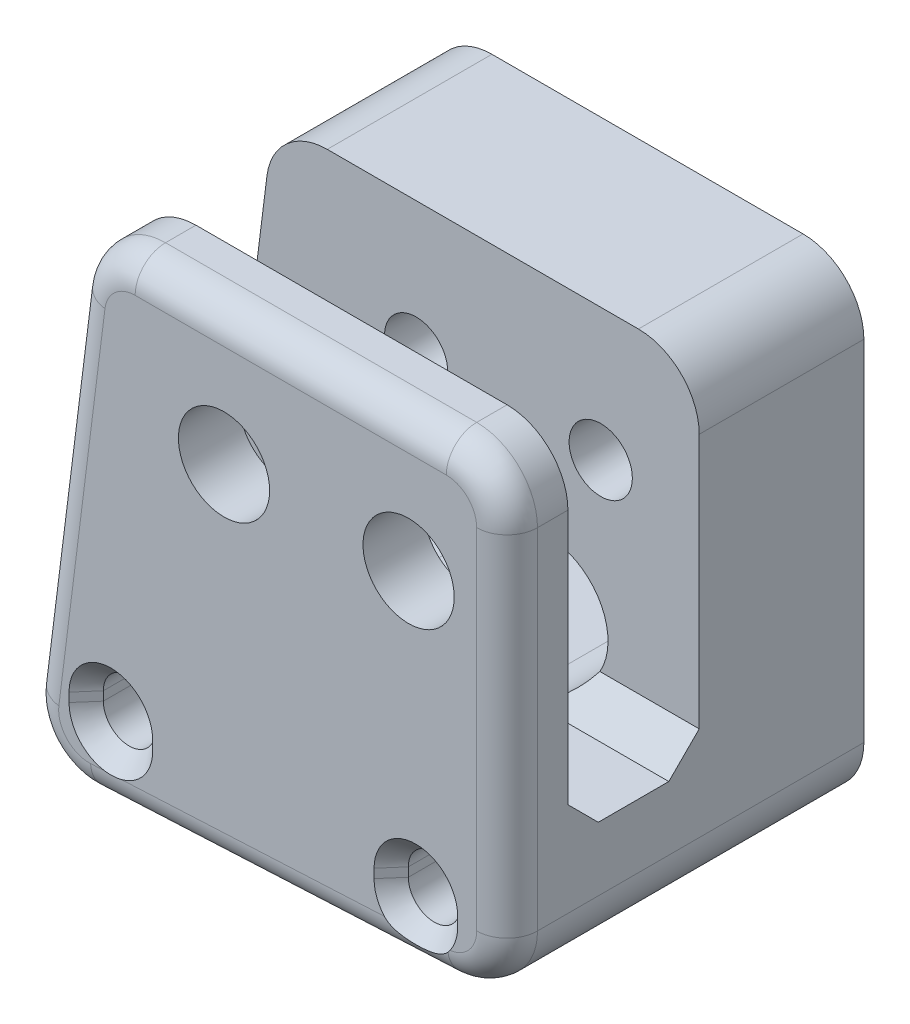
from build123d import *

# Parameters (mm, degrees)
BOSS_EXTRUDE1_DEPTH                           = 3.175
BOSS_EXTRUDE2_START                           = -6.858
BOSS_EXTRUDE2_DEPTH                           = 8.5979
BOSS_EXTRUDE3_DEPTH                           = 6.858
CSK_START                                     = -16
CSK_SLOT_FOR_2_FLAT_HEAD_MACHINE_SCREW1_DEPTH = 20
FILLET1_R                                     = 3.175
CHAMFER1_SIZE                                 = 1.5875
F_3_16_0_1875_DIAMETER_HOLE1_D                = 4.7625
F_3_16_0_1875_DIAMETER_HOLE1_DEPTH            = 3.175
F_0_CLEARANCE_HOLE1_D                         = 1.8542
HOLE1_AT_2_COUNT                              = 2
HOLE1_AT_2_PITCH                              = 9.6393
CUT_EXTRUDE2_REACH                            = 30.918
FILLET3_R                                     = 1.5875


with BuildPart() as part:
    # Sketch1 → Boss-Extrude1 (new body)
    with BuildSketch(Plane.XY):
        Polygon((9.9949, 9.271), (9.9949, -15.162995595), (-15.457511269, -16.426312325), (-12.2301, 9.271), align=None)
    extrude(amount=BOSS_EXTRUDE1_DEPTH)



with BuildPart() as body_2:
    # Sketch1<2> → Boss-Extrude2 (new body)
    with BuildSketch(Plane.XY.offset(BOSS_EXTRUDE2_START)):
        Polygon((9.9949, 9.271), (9.9949, -15.162995595), (-15.457511269, -16.426312325), (-12.2301, 9.271), align=None)
    extrude(amount=-BOSS_EXTRUDE2_DEPTH)


with BuildPart() as part_1:
    add(part.part)

    add(body_2.part)  # Boss-Extrude3 merges body 2
    # Sketch3 → Boss-Extrude3 (add)
    with BuildSketch(Plane.XY.offset(-6.858)):
        Polygon((9.9949, -8.812995595), (9.9949, -15.162995595), (-15.457511269, -16.426312325), (-14.501329397, -8.812995595), align=None)
    extrude(amount=BOSS_EXTRUDE3_DEPTH)

    # CSK SLOT for #2 Flat Head Machine Screw1: read off the stored shape, not the designer's step
    # CSK SLOT for _2 Flat Head Machine Sc 2 → CSK SLOT for #2 Flat Head Machine Screw1 (cut)
    with BuildSketch(Plane.XY.offset(CSK_START)):
        with BuildLine():
            Line((-9.342461269, -12.455421191), (-9.342461269, -11.985521191))
            ThreePointArc((-9.342461269, -11.985521191), (-10.695011269, -10.632971191), (-12.047561269, -11.985521191))
            Line((-12.047561269, -11.985521191), (-12.047561269, -12.455421191))
            ThreePointArc((-12.047561269, -12.455421191), (-10.695011269, -13.807971191), (-9.342461269, -12.455421191))
        make_face()
        with BuildLine():
            Line((6.58495, -12.455421191), (6.58495, -11.985521191))
            ThreePointArc((6.58495, -11.985521191), (5.2324, -10.632971191), (3.87985, -11.985521191))
            Line((3.87985, -11.985521191), (3.87985, -12.455421191))
            ThreePointArc((3.87985, -12.455421191), (5.2324, -13.807971191), (6.58495, -12.455421191))
        make_face()
    extrude(amount=CSK_SLOT_FOR_2_FLAT_HEAD_MACHINE_SCREW1_DEPTH, mode=Mode.SUBTRACT)

    # CSK SLOT for _2 Flat Head Machine Sc 3: loft between two sections, ruled curve by curve
    csk_slot_for_2_flat_head_machine_sc_3_from = [
        Edge.make_three_point_arc((-9.342461269, -11.985521191, 2.21806604), (-9.738613992, -11.029123914, 2.21806604), (-10.695011269, -10.632971191, 2.21806604)),
        Edge.make_three_point_arc((-10.695011269, -10.632971191, 2.21806604), (-11.651408546, -11.029123914, 2.21806604), (-12.047561269, -11.985521191, 2.21806604)),
        Edge.make_three_point_arc((-12.047561269, -12.455421191, 2.21806604), (-11.651408546, -13.411818468, 2.21806604), (-10.695011269, -13.807971191, 2.21806604)),
        Edge.make_three_point_arc((-10.695011269, -13.807971191, 2.21806604), (-9.738613992, -13.411818468, 2.21806604), (-9.342461269, -12.455421191, 2.21806604)),
        Edge.make_line((-12.047561269, -11.985521191, 2.21806604), (-12.047561269, -12.455421191, 2.21806604)),
        Edge.make_line((-9.342461269, -11.985521191, 2.21806604), (-9.342461269, -12.455421191, 2.21806604)),
    ]
    csk_slot_for_2_flat_head_machine_sc_3_to = [
        Edge.make_three_point_arc((-8.510611269, -11.985521191, 3.175), (-9.150407216, -10.440917138, 3.175), (-10.695011269, -9.801121191, 3.175)),
        Edge.make_three_point_arc((-10.695011269, -9.801121191, 3.175), (-12.239615322, -10.440917138, 3.175), (-12.879411269, -11.985521191, 3.175)),
        Edge.make_three_point_arc((-12.879411269, -12.455421191, 3.175), (-12.239615322, -14.000025244, 3.175), (-10.695011269, -14.639821191, 3.175)),
        Edge.make_three_point_arc((-10.695011269, -14.639821191, 3.175), (-9.150407216, -14.000025244, 3.175), (-8.510611269, -12.455421191, 3.175)),
        Edge.make_line((-12.879411269, -11.985521191, 3.175), (-12.879411269, -12.455421191, 3.175)),
        Edge.make_line((-8.510611269, -11.985521191, 3.175), (-8.510611269, -12.455421191, 3.175)),
    ]
    csk_slot_for_2_flat_head_machine_sc_3 = Solid(Shell([*[Face.make_surface_from_curves(csk_slot_for_2_flat_head_machine_sc_3_from[k], csk_slot_for_2_flat_head_machine_sc_3_to[k]) for k in range(6)], Face(Wire(csk_slot_for_2_flat_head_machine_sc_3_from)), Face(Wire(csk_slot_for_2_flat_head_machine_sc_3_to))]))
    add(csk_slot_for_2_flat_head_machine_sc_3, mode=Mode.SUBTRACT)

    # CSK SLOT for _2 Flat Head Machine Sc 4: loft between two sections, ruled curve by curve
    csk_slot_for_2_flat_head_machine_sc_4_from = [
        Edge.make_three_point_arc((6.58495, -11.985521191, 2.21806604), (6.188797277, -11.029123914, 2.21806604), (5.2324, -10.632971191, 2.21806604)),
        Edge.make_three_point_arc((5.2324, -10.632971191, 2.21806604), (4.276002723, -11.029123914, 2.21806604), (3.87985, -11.985521191, 2.21806604)),
        Edge.make_three_point_arc((3.87985, -12.455421191, 2.21806604), (4.276002723, -13.411818468, 2.21806604), (5.2324, -13.807971191, 2.21806604)),
        Edge.make_three_point_arc((5.2324, -13.807971191, 2.21806604), (6.188797277, -13.411818468, 2.21806604), (6.58495, -12.455421191, 2.21806604)),
        Edge.make_line((3.87985, -11.985521191, 2.21806604), (3.87985, -12.455421191, 2.21806604)),
        Edge.make_line((6.58495, -11.985521191, 2.21806604), (6.58495, -12.455421191, 2.21806604)),
    ]
    csk_slot_for_2_flat_head_machine_sc_4_to = [
        Edge.make_three_point_arc((7.4168, -11.985521191, 3.175), (6.777004053, -10.440917138, 3.175), (5.2324, -9.801121191, 3.175)),
        Edge.make_three_point_arc((5.2324, -9.801121191, 3.175), (3.687795947, -10.440917138, 3.175), (3.048, -11.985521191, 3.175)),
        Edge.make_three_point_arc((3.048, -12.455421191, 3.175), (3.687795947, -14.000025244, 3.175), (5.2324, -14.639821191, 3.175)),
        Edge.make_three_point_arc((5.2324, -14.639821191, 3.175), (6.777004053, -14.000025244, 3.175), (7.4168, -12.455421191, 3.175)),
        Edge.make_line((3.048, -11.985521191, 3.175), (3.048, -12.455421191, 3.175)),
        Edge.make_line((7.4168, -11.985521191, 3.175), (7.4168, -12.455421191, 3.175)),
    ]
    csk_slot_for_2_flat_head_machine_sc_4 = Solid(Shell([*[Face.make_surface_from_curves(csk_slot_for_2_flat_head_machine_sc_4_from[k], csk_slot_for_2_flat_head_machine_sc_4_to[k]) for k in range(6)], Face(Wire(csk_slot_for_2_flat_head_machine_sc_4_from)), Face(Wire(csk_slot_for_2_flat_head_machine_sc_4_to))]))
    add(csk_slot_for_2_flat_head_machine_sc_4, mode=Mode.SUBTRACT)

    # Fillet1
    fillet1_edges = [part_1.edges().sort_by_distance(p)[0] for p in [
        (-12.2301, 9.271, -11.15695),
        (9.9949, 9.271, -11.15695),
        (9.9949, 9.271, 1.5875),
        (9.9949, -15.162995595, -6.14045),
        (-15.457511269, -16.426312325, -6.14045),
        (-12.2301, 9.271, 1.5875),
    ]]
    fillet(fillet1_edges, radius=FILLET1_R)

    # Chamfer1
    chamfer1_edges = [part_1.edges().sort_by_distance(p)[0] for p in [
        (-2.253214698, -8.812995595, -6.858),
        (-2.253214698, -8.812995595, 0),
    ]]
    chamfer(chamfer1_edges, length=CHAMFER1_SIZE)

    # 3/16 (0.1875) Diameter Hole1
    with Locations(Plane.XY.offset(3.175)):
        with Locations((4.8514, 2.3622), (-4.7879, 2.3622)):
            Hole(F_3_16_0_1875_DIAMETER_HOLE1_D / 2, depth=F_3_16_0_1875_DIAMETER_HOLE1_DEPTH)

    # #0 Clearance Hole1 (through all)
    with Locations(Plane(origin=(0, 0, -15.4559), x_dir=(-1, 0, 0), z_dir=(0, 0, -1))):
        with Locations((-4.8514, 2.3622), (4.7879, 2.3622)):
            Hole(F_0_CLEARANCE_HOLE1_D / 2)

    # Sketch11 → Hole1 (revolve, cut)
    with BuildSketch(Plane(origin=(4.8514, 2.3622, -6.858), x_dir=(0, -1, 0), z_dir=(1, 0, 0))):
        Polygon((0, 0), (0, 3.048), (1.524, 3.048), (1.651, 0), align=None)
    hole1 = revolve(axis=Axis((4.8514, 2.3622, -116.858), (0, 0, 1)), mode=Mode.SUBTRACT)

    # Hole1 at 2: Hole1 ×2
    with Locations(*[(-i * HOLE1_AT_2_PITCH, 0, 0) for i in range(1, HOLE1_AT_2_COUNT)]):
        add(hole1, mode=Mode.SUBTRACT)

    # Sketch13 → Cut-Extrude2 (cut, up to next)
    with BuildSketch(Plane(origin=(0, 0, -15.4559), x_dir=(-1, 0, 0), z_dir=(0, 0, -1)), mode=Mode.PRIVATE) as cut_extrude2_sk1:
        with BuildLine():
            Line((-2.0574, -2.462995595), (6.127656415, -2.462995595))
            ThreePointArc((6.127656415, -2.462995595), (9.302656415, -5.637995595), (6.127656415, -8.812995595))
            Line((6.127656415, -8.812995595), (-2.0574, -8.812995595))
            ThreePointArc((-2.0574, -8.812995595), (-5.2324, -5.637995595), (-2.0574, -2.462995595))
        make_face()
    cut_extrude2_tool1 = extrude(cut_extrude2_sk1.sketch, amount=-CUT_EXTRUDE2_REACH, mode=Mode.PRIVATE) & part_1.part
    add(cut_extrude2_tool1.solids().sort_by_distance((-2.035128, -5.637996, -15.4559))[0], mode=Mode.SUBTRACT)

    # Fillet3
    # the kernel refuses this fillet: 1.5875 mm, written as the material it takes off along each edge
    with BuildSketch(Plane(origin=(-14.985993213, -12.67198858, 3.175), x_dir=(0.9922052502363689, -0.12461437077393937, 0), z_dir=(0.12461437077393936, 0.9922052502363689, 0))) as fillet3_piece_1:
        with BuildLine():
            CenterArc((FILLET3_R, FILLET3_R), FILLET3_R, 180, 90)
            Line((0, FILLET3_R), (0, 0))
            Line((0, 0), (FILLET3_R, 0))
        make_face()
    extrude(amount=19.314188473, mode=Mode.SUBTRACT)
    with BuildSketch(Plane(origin=(-9.4289161, 9.271, 3.175), x_dir=(0, -1, 0), z_dir=(1, 0, 0))) as fillet3_piece_2:
        with BuildLine():
            CenterArc((FILLET3_R, FILLET3_R), FILLET3_R, 180, 90)
            Line((0, FILLET3_R), (0, 0))
            Line((0, 0), (FILLET3_R, 0))
        make_face()
    extrude(amount=16.2488161, mode=Mode.SUBTRACT)
    with BuildSketch(Plane(origin=(6.977295656, -15.312772762, 3.175), x_dir=(-0.04957343510019617, 0.9987704814081995, 0), z_dir=(-0.9987704814081996, -0.049573435100196184, 0))) as fillet3_piece_3:
        with BuildLine():
            CenterArc((FILLET3_R, FILLET3_R), FILLET3_R, 180, 90)
            Line((0, FILLET3_R), (0, 0))
            Line((0, 0), (FILLET3_R, 0))
        make_face()
    extrude(amount=18.678607238, mode=Mode.SUBTRACT)
    with BuildSketch(Plane(origin=(9.9949, 6.096, 3.175), x_dir=(0, 0, -1), z_dir=(0, -1, 0))) as fillet3_piece_4:
        with BuildLine():
            CenterArc((FILLET3_R, -FILLET3_R), FILLET3_R, 90, 90)
            Line((0, -FILLET3_R), (0, 0))
            Line((0, 0), (FILLET3_R, 0))
        make_face()
    extrude(amount=18.237676483, mode=Mode.SUBTRACT)
    with BuildSketch(Plane(origin=(-11.835741543, -13.067639207, 3.175), x_dir=(0.04957343510019569, -0.9987704814081997, 0), z_dir=(0.9987704814081997, 0.04957343510019569, 0))) as fillet3_piece_5:
        with BuildLine():
            CenterArc((3.175 - FILLET3_R, FILLET3_R), FILLET3_R, 270, 90)
            Line((3.175, FILLET3_R), (3.175, 0))
            Line((3.175, 0), (3.175 - FILLET3_R, 0))
        make_face()
    revolve(axis=Axis((-11.835741543, -13.067639207, 3.175), (0, 0, -1)), revolution_arc=100, mode=Mode.SUBTRACT)
    with BuildSketch(Plane(origin=(6.8199, -12.141676483, 3.175), x_dir=(1, 0, 0), z_dir=(0, 1, 0))) as fillet3_piece_6:
        with BuildLine():
            CenterArc((3.175 - FILLET3_R, FILLET3_R), FILLET3_R, 270, 90)
            Line((3.175, FILLET3_R), (3.175, 0))
            Line((3.175, 0), (3.175 - FILLET3_R, 0))
        make_face()
    revolve(axis=Axis((6.8199, -12.141676483, 3.175), (0, 0, -1)), revolution_arc=87.158486733, mode=Mode.SUBTRACT)
    with BuildSketch(Plane(origin=(6.8199, 6.096, 3.175), x_dir=(1, 0, 0), z_dir=(0, -1, 0))) as fillet3_piece_7:
        with BuildLine():
            CenterArc((3.175 - FILLET3_R, -FILLET3_R), FILLET3_R, 0, 90)
            Line((3.175 - FILLET3_R, 0), (3.175, 0))
            Line((3.175, 0), (3.175, -FILLET3_R))
        make_face()
    revolve(axis=Axis((6.8199, 6.096, 3.175), (0, 0, 1)), revolution_arc=90, mode=Mode.SUBTRACT)
    with BuildSketch(Plane(origin=(-9.4289161, 6.096, 3.175), x_dir=(0, 1, 0), z_dir=(1, 0, 0))) as fillet3_piece_8:
        with BuildLine():
            CenterArc((3.175 - FILLET3_R, -FILLET3_R), FILLET3_R, 0, 90)
            Line((3.175, -FILLET3_R), (3.175, 0))
            Line((3.175, 0), (3.175 - FILLET3_R, 0))
        make_face()
    revolve(axis=Axis((-9.4289161, 6.096, 3.175), (0, 0, 1)), revolution_arc=82.841513267, mode=Mode.SUBTRACT)


solid = part_1.part
